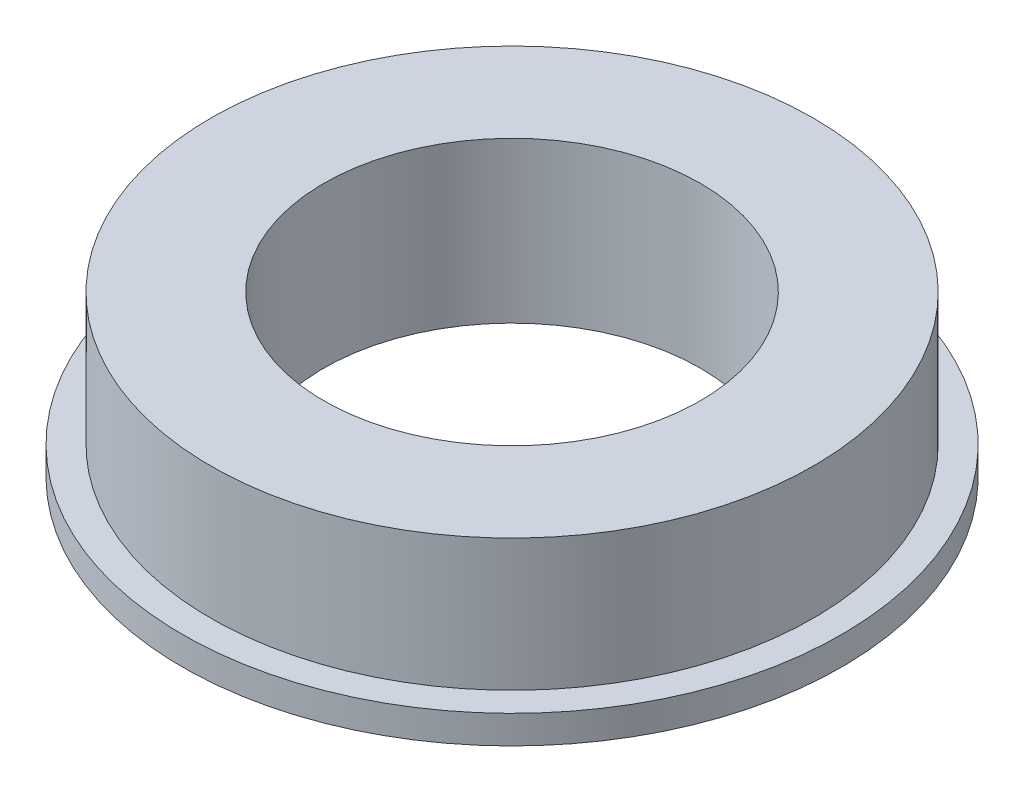
from build123d import *


with BuildPart() as part:
    # 草图1 → 旋转1 (revolve)
    with BuildSketch(Plane.XY):
        Polygon((16, 1.5), (16, 8.5), (10, 8.5), (10, 0), (17.5, 0), (17.5, 1.5), align=None)
    revolve(axis=Axis((0, 7, 0), (0, -1, 0)))


solid = part.part
